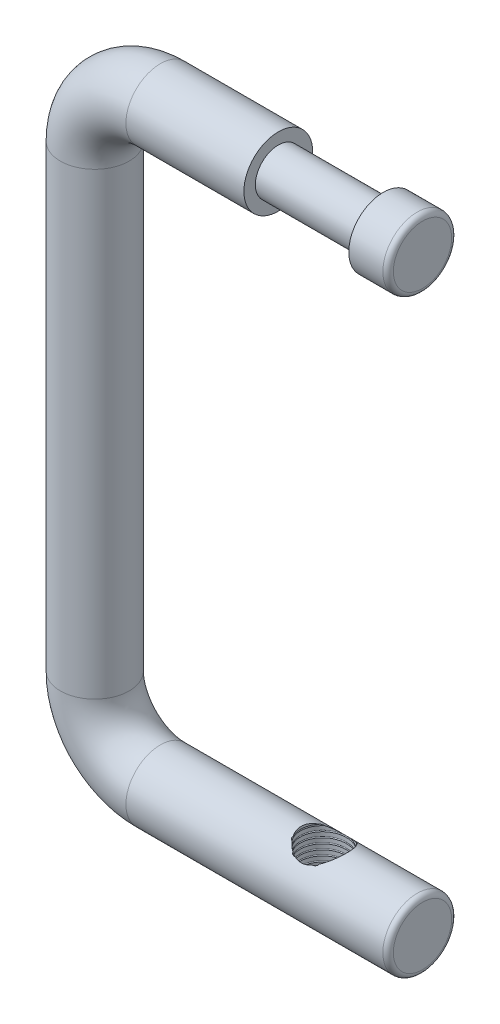
from build123d import *

# Parameters (mm, degrees)
SKETCH1_R               = 5.25
SKETCH4_R               = 5.25
SKETCH4_R_2             = 3.5
FILLET2_R               = 0.8
FILLET3_R               = 0.8
CUT_EXTRUDE1_DEPTH      = 7
CUT_EXTRUDE1_DEPTH_BACK = 106.948985508
SKETCH6_R               = 3.5
CUT_SWEEP3_PITCH        = 0.8


with BuildPart() as part:
    # Sweep2: sweep along a path in Sketch2
    with BuildLine(Plane.XY) as sweep2_path:
        Line((0, 0), (-40, 0))
        ThreePointArc((-40, 0), (-47.071067812, -2.928932188), (-50, -10))
        Line((-50, -10), (-50, -80))
        ThreePointArc((-50, -80), (-47.071067812, -87.071067812), (-40, -90))
        Line((-40, -90), (0, -90))
    # Sketch1 → Sweep2 (sweep)
    with BuildSketch(Plane(origin=(0, 0, 0), x_dir=(0, 0, -1), z_dir=(1, 0, 0))):
        Circle(SKETCH1_R)
    sweep(path=sweep2_path.line)

    # Cut-Sweep2: sweep along a path in Sketch5
    with BuildLine(Plane.XY) as cut_sweep2_path:
        Line((-6, 0), (-22, 0))
    # Sketch4 → Cut-Sweep2 (sweep, cut)
    with BuildSketch(Plane(origin=(-6, 0, 0), x_dir=(0, 0, -1), z_dir=(1, 0, 0))):
        Circle(SKETCH4_R)
        Circle(SKETCH4_R_2, mode=Mode.SUBTRACT)
    sweep(path=cut_sweep2_path.line, mode=Mode.SUBTRACT)

    # Fillet2
    fillet2_edges = [part.edges().sort_by_distance(p)[0] for p in [
        (0, -90, 5.25),
    ]]
    fillet(fillet2_edges, radius=FILLET2_R)

    # Fillet3
    fillet3_edges = [part.edges().sort_by_distance(p)[0] for p in [
        (0, 0, 5.25),
    ]]
    fillet(fillet3_edges, radius=FILLET3_R)

    # Sketch6 → Cut-Extrude1 (cut, two sides: drawn at the far end of the back side and taken through both)
    with BuildSketch(Plane(origin=(0, -85, 0), x_dir=(1, 0, 0), z_dir=(0, 1, 0)).offset(-CUT_EXTRUDE1_DEPTH_BACK)):
        with Locations(Location((-15, 0, 0), (0, 0, 179.999999963))):
            Circle(SKETCH6_R)
    extrude(amount=CUT_EXTRUDE1_DEPTH + CUT_EXTRUDE1_DEPTH_BACK, mode=Mode.SUBTRACT)

    # Cut-Sweep3: arcs per turn and ends read off the stored shape
    # Cut-Sweep3: the profile of Sketch9 screwed along a right-hand helix through 12.5 turns, 8 arcs to a turn; built about Z, then put on its axis
    cut_sweep3_z = Axis((0, 0, 0), (0, 0, 1))
    cut_sweep3_corners = [(3.4, 0, 1e-08), (3.5, 0, -0.09999999), (3.6, 0, 1e-08), (3.5, 0, 0.10000001)]
    with BuildLine(mode=Mode.PRIVATE) as cut_sweep3_profile:
        ThreePointArc((3.4, 0, 1e-08), (3.429289322, 0, -0.070710668), (3.5, 0, -0.09999999))
        ThreePointArc((3.5, 0, -0.09999999), (3.570710678, 0, -0.070710668), (3.6, 0, 1e-08))
        ThreePointArc((3.6, 0, 1e-08), (3.570710678, 0, 0.070710688), (3.5, 0, 0.10000001))
        ThreePointArc((3.5, 0, 0.10000001), (3.429289322, 0, 0.070710688), (3.4, 0, 1e-08))
    cut_sweep3_cap = Face(cut_sweep3_profile.wire())
    cut_sweep3_arcs = [((3.4, 0, 1e-08), (3.4, 0, -0.09999999), (3.5, 0, -0.09999999), (1, 0.7071067811865476, 1)), ((3.5, 0, -0.09999999), (3.6, 0, -0.09999999), (3.6, 0, 1e-08), (1, 0.7071067811865476, 1)), ((3.6, 0, 1e-08), (3.6, 0, 0.10000001), (3.5, 0, 0.10000001), (1, 0.7071067811865476, 1)), ((3.5, 0, 0.10000001), (3.4, 0, 0.10000001), (3.4, 0, 1e-08), (1, 0.7071067811865476, 1))]  # start, shoulder, end, weights
    cut_sweep3_turn_angles = [0, 22.5, 45, 67.5, 90, 112.5, 135, 157.5, 180, 202.5, 225, 247.5, 270, 292.5, 315, 337.5, 360]
    cut_sweep3_turn_weights = [1, 0.9238795325112867, 1, 0.9238795325112867, 1, 0.9238795325112867, 1, 0.9238795325112867, 1, 0.9238795325112867, 1, 0.9238795325112867, 1, 0.9238795325112867, 1, 0.9238795325112867, 1]
    cut_sweep3_turn_sides = [Face.make_bezier_surface([[Vector(p[j][0], p[j][1], 0).rotate(cut_sweep3_z, cut_sweep3_turn_angles[2 * i + k]) / cut_sweep3_turn_weights[2 * i + k] + Vector(0, 0, p[j][2] + CUT_SWEEP3_PITCH * cut_sweep3_turn_angles[2 * i + k] / 360) for k in range(3)] for j in range(3)], [[p[3][j] * cut_sweep3_turn_weights[2 * i + k] for k in range(3)] for j in range(3)]) for p in cut_sweep3_arcs for i in range(8)]
    cut_sweep3_last_angles = [4320, 4342.5, 4365, 4387.5, 4410, 4432.5, 4455, 4477.5, 4500]
    cut_sweep3_last_weights = [1, 0.9238795325112867, 1, 0.9238795325112867, 1, 0.9238795325112867, 1, 0.9238795325112047, 1]
    cut_sweep3_last_sides = [Face.make_bezier_surface([[Vector(p[j][0], p[j][1], 0).rotate(cut_sweep3_z, cut_sweep3_last_angles[2 * i + k]) / cut_sweep3_last_weights[2 * i + k] + Vector(0, 0, p[j][2] + CUT_SWEEP3_PITCH * cut_sweep3_last_angles[2 * i + k] / 360) for k in range(3)] for j in range(3)], [[p[3][j] * cut_sweep3_last_weights[2 * i + k] for k in range(3)] for j in range(3)]) for p in cut_sweep3_arcs for i in range(4)]
    cut_sweep3 = Plane(origin=(-15, -85, 0), x_dir=(0, 0, 1), z_dir=(0, -1, 0)) * Solid(Shell([*[p.moved(Location((0, 0, CUT_SWEEP3_PITCH * i))) for i in range(12) for p in cut_sweep3_turn_sides], *cut_sweep3_last_sides, cut_sweep3_cap, cut_sweep3_cap.rotate(cut_sweep3_z, 4500).moved(Location((0, 0, CUT_SWEEP3_PITCH * 4500 / 360)))]))
    add(cut_sweep3, mode=Mode.SUBTRACT)


solid = part.part
